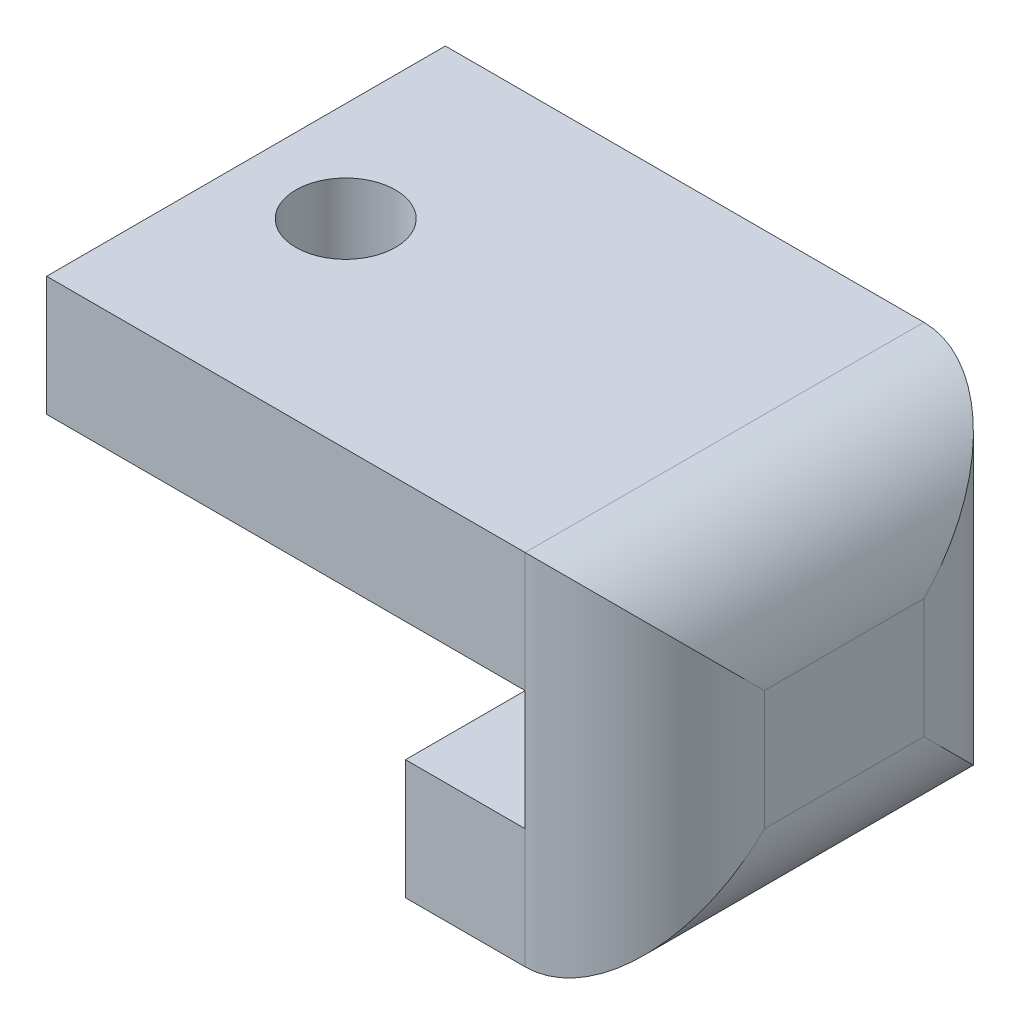
from build123d import *

# Parameters (mm, degrees)
ESTRUSIONE_ESTRUSIONE1_DEPTH = 10
RACCORDO1_R                  = 3
FORO_FILETTATO_M3X0_5_1_D    = 2.5


with BuildPart() as part:
    # Schizzo1 → Estrusione-Estrusione1 (new body)
    with BuildSketch(Plane.XY):
        Polygon((-6, 0), (6, 0), (6, -3), (3, -3), (3, -6), (9, -6), (9, 3), (-6, 3), align=None)
    extrude(amount=ESTRUSIONE_ESTRUSIONE1_DEPTH)

    # Raccordo1
    raccordo1_edges = [part.edges().sort_by_distance(p)[0] for p in [
        (9, 3, 5),
        (9, -6, 5),
        (9, -1.5, 10),
        (9, -1.5, 0),
    ]]
    fillet(raccordo1_edges, radius=RACCORDO1_R - 0.0001)  # a hair under: the kernel refuses the full size

    # Foro filettato M3x0.5-1 (through all)
    with Locations(Plane(origin=(0, 3, 0), x_dir=(1, 0, 0), z_dir=(0, 1, 0))):
        with Locations((-3.5, -5)):
            Hole(FORO_FILETTATO_M3X0_5_1_D / 2)


solid = part.part
